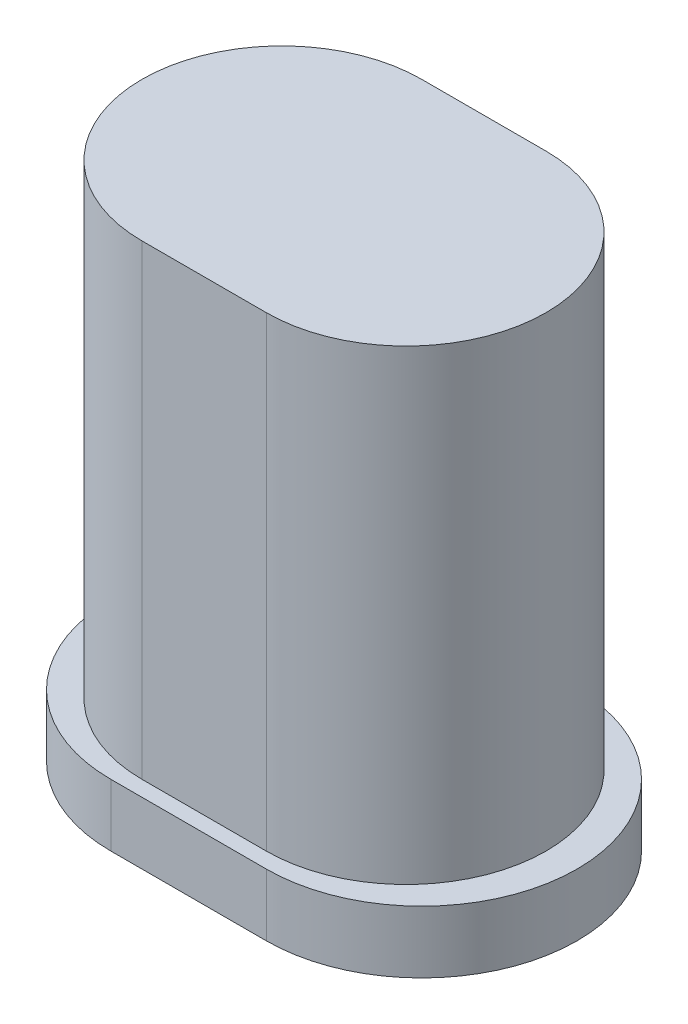
from build123d import *

# Parameters (mm, degrees)
BOSS_EXTRUDE1_DEPTH = 1
BOSS_EXTRUDE2_DEPTH = 7.5


with BuildPart() as part:
    # Sketch1 → Boss-Extrude1 (new body)
    with BuildSketch(Plane(origin=(0, 0, 0), x_dir=(1, 0, 0), z_dir=(0, 1, 0))):
        with BuildLine():
            Line((-1.25, 2.5), (1.25, 2.5))
            ThreePointArc((1.25, 2.5), (3.75, 0), (1.25, -2.5))
            Line((1.25, -2.5), (-1.25, -2.5))
            ThreePointArc((-1.25, -2.5), (-3.75, 0), (-1.25, 2.5))
        make_face()
    extrude(amount=BOSS_EXTRUDE1_DEPTH)

    # Sketch2 → Boss-Extrude2 (add)
    with BuildSketch(Plane(origin=(0, 1, 0), x_dir=(1, 0, 0), z_dir=(0, 1, 0))):
        with BuildLine():
            Line((-1, 2.25), (1, 2.25))
            ThreePointArc((1, 2.25), (3.25, 0), (1, -2.25))
            Line((1, -2.25), (-1, -2.25))
            ThreePointArc((-1, -2.25), (-3.25, 0), (-1, 2.25))
        make_face()
    extrude(amount=BOSS_EXTRUDE2_DEPTH)


solid = part.part
